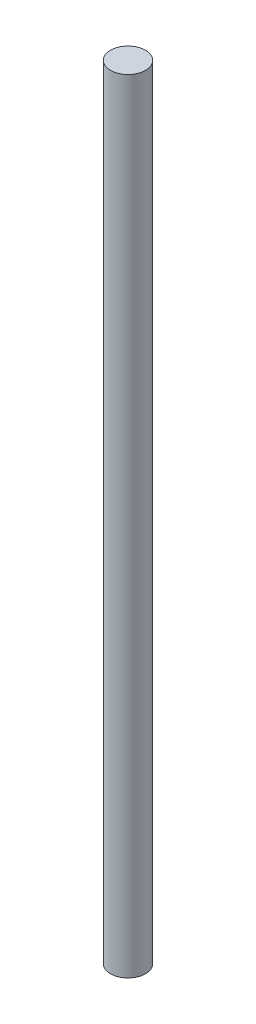
from build123d import *

# Parameters (mm, degrees)
SKETCH1_R           = 3.35
BOSS_EXTRUDE1_DEPTH = 150


with BuildPart() as part:
    # Sketch1 → Boss-Extrude1 (new body)
    with BuildSketch(Plane(origin=(0, 0, 0), x_dir=(1, 0, 0), z_dir=(0, 1, 0))):
        Circle(SKETCH1_R)
    extrude(amount=BOSS_EXTRUDE1_DEPTH)


solid = part.part
